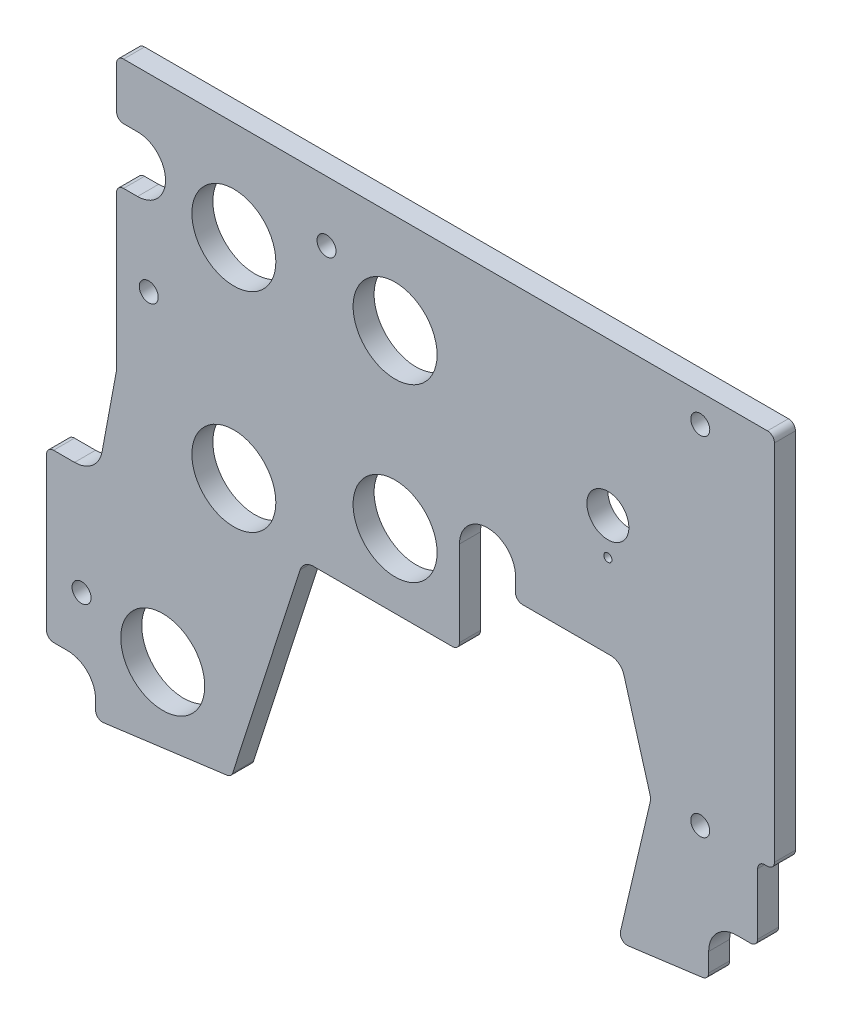
from build123d import *

# Parameters (mm, degrees)
BOSS_EXTRUDE1_DEPTH   = 4.7625
F_6_CLEARANCE_HOLE1_D = 4.3053
SKETCH5_R             = 9.525
SKETCH5_R_2           = 4.7625
CUT_EXTRUDE1_DEPTH    = 215.066671615
F_0_CLEARANCE_HOLE1_D = 1.8542


with BuildPart() as part:
    # Sketch1 → Boss-Extrude1 (new body)
    with BuildSketch(Plane.XY):
        with BuildLine():
            Line((-1.58748798, -85.534500226), (-1.587499702, -3.175000338))
            ThreePointArc((-1.587499702, -3.175000338), (-2.052467807, -2.052468316), (-3.174999928, -1.587500451))
            Line((-3.174999928, -1.587500451), (-149.225000608, -1.587521198))
            ThreePointArc((-149.225000608, -1.587521198), (-150.34753241, -2.052489195), (-150.812500382, -3.175021007))
            Line((-150.812500382, -3.175021007), (-150.812501529, -12.700020556))
            ThreePointArc((-150.812501529, -12.700020556), (-150.347533612, -13.822552695), (-149.225001529, -14.287520747))
            Line((-149.225001529, -14.287520747), (-146.049997068, -14.287520747))
            ThreePointArc((-146.049997068, -14.287520747), (-139.699997068, -20.637520747), (-146.049997068, -26.987520747))
            Line((-146.049997068, -26.987520747), (-149.225013631, -26.987520747))
            ThreePointArc((-149.225013631, -26.987520747), (-150.347545646, -27.452488732), (-150.812513631, -28.575020747))
            Line((-150.812513631, -28.575020747), (-150.812513631, -63.3538504))
            ThreePointArc((-150.812513631, -63.3538504), (-150.819200601, -63.499405937), (-150.839205177, -63.643735238))
            Line((-150.839205177, -63.643735238), (-154.094231629, -81.169566712))
            ThreePointArc((-154.094231629, -81.169566712), (-156.277952028, -84.892947063), (-160.337486649, -86.360044427))
            Line((-160.337486649, -86.360044427), (-165.099987777, -86.360045103))
            ThreePointArc((-165.099987777, -86.360045103), (-166.222519646, -86.825013168), (-166.687487552, -87.947545103))
            Line((-166.687487552, -87.947545103), (-166.687487552, -122.545535149))
            ThreePointArc((-166.687487552, -122.545535149), (-166.222519567, -123.668067164), (-165.099987552, -124.133035149))
            Line((-165.099987552, -124.133035149), (-161.924987552, -124.133035149))
            ThreePointArc((-161.924987552, -124.133035149), (-157.434859491, -125.992907088), (-155.574987552, -130.483035149))
            Line((-155.574987552, -130.483035149), (-155.574987552, -132.640440399))
            ThreePointArc((-155.574987552, -132.640440399), (-155.034199033, -133.833986093), (-153.780277221, -134.214359116))
            Line((-153.780277221, -134.214359116), (-125.771097932, -130.526880708))
            ThreePointArc((-125.771097932, -130.526880708), (-124.961326394, -130.171938663), (-124.467007026, -129.438888758))
            Line((-124.467007026, -129.438888758), (-109.180488679, -81.895646464))
            ThreePointArc((-109.180488679, -81.895646464), (-108.028045294, -80.301738907), (-106.157886207, -79.6925))
            Line((-106.157886207, -79.6925), (-74.612491751, -79.6925))
            ThreePointArc((-74.612491751, -79.6925), (-73.489959736, -79.227532015), (-73.024991751, -78.105))
            Line((-73.024991751, -78.105), (-73.024991751, -58.7375))
            ThreePointArc((-73.024991751, -58.7375), (-66.674991751, -52.3875), (-60.324991751, -58.7375))
            Line((-60.324991751, -58.7375), (-60.324991751, -61.9125))
            ThreePointArc((-60.324991751, -61.9125), (-59.860023766, -63.035032015), (-58.737491751, -63.5))
            Line((-58.737491751, -63.5), (-38.786604302, -63.5))
            ThreePointArc((-38.786604302, -63.5), (-36.87752741, -64.138062787), (-35.735764486, -65.795795009))
            Line((-35.735764486, -65.795795009), (-29.83134609, -86.284116742))
            ThreePointArc((-29.83134609, -86.284116742), (-29.708193003, -87.083358908), (-29.790944576, -87.887788459))
            Line((-29.790944576, -87.887788459), (-36.522349245, -116.610151533))
            ThreePointArc((-36.522349245, -116.610151533), (-36.153591729, -118.037818788), (-34.769518371, -118.546303629))
            Line((-34.769518371, -118.546303629), (-17.8902735, -116.324110206))
            ThreePointArc((-17.8902735, -116.324110206), (-16.903937981, -115.796902916), (-16.509983709, -114.750191247))
            Line((-16.509983709, -114.750191247), (-16.509984311, -110.516938696))
            ThreePointArc((-16.509984311, -110.516938696), (-14.655116284, -106.017688645), (-10.160000902, -104.152822935))
            Line((-10.160000902, -104.152822935), (-6.9849852, -104.152822484))
            ThreePointArc((-6.9849852, -104.152822484), (-5.862453251, -103.687854339), (-5.397485425, -102.565322258))
            Line((-5.397485425, -102.565322258), (-5.397487394, -88.709500767))
            ThreePointArc((-5.397487394, -88.709500767), (-4.932519529, -87.586968646), (-3.809987507, -87.122000541))
            Line((-3.809987507, -87.122000541), (-3.17498789, -87.122000474))
            ThreePointArc((-3.17498789, -87.122000474), (-2.052455852, -86.657032363), (-1.58748798, -85.534500226))
        make_face()
    extrude(amount=BOSS_EXTRUDE1_DEPTH)

    # #6 Clearance Hole1 (through all)
    with Locations(Plane.XY.offset(4.7625)):
        with Locations((-103.187497835, -15.240014659), (-18.414998872, -7.937503157), (-143.510001128, -44.450020387), (-158.750001128, -111.125021649), (-18.414987678, -86.741003157)):
            Hole(F_6_CLEARANCE_HOLE1_D / 2)

    # Sketch5 → Cut-Extrude1 (cut, through all)
    with BuildSketch(Plane.XY.offset(4.7625)):
        with Locations((-124.205996572, -24.130021649)):
            Circle(SKETCH5_R)
        with Locations((-87.63, -24.130021649)):
            Circle(SKETCH5_R)
        with Locations((-87.63, -62.992021649)):
            Circle(SKETCH5_R)
        with Locations((-124.205996572, -71.437521424)):
            Circle(SKETCH5_R)
        with Locations((-140.334987552, -115.57)):
            Circle(SKETCH5_R)
        with Locations((-39.36999484, -36.322003157)):
            Circle(SKETCH5_R_2)
    extrude(amount=-CUT_EXTRUDE1_DEPTH, mode=Mode.SUBTRACT)

    # #0 Clearance Hole1 (through all)
    with Locations(Plane.XY.offset(6.35)):
        with Locations((-39.36999484, -44.577003157)):
            Hole(F_0_CLEARANCE_HOLE1_D / 2)


solid = part.part
